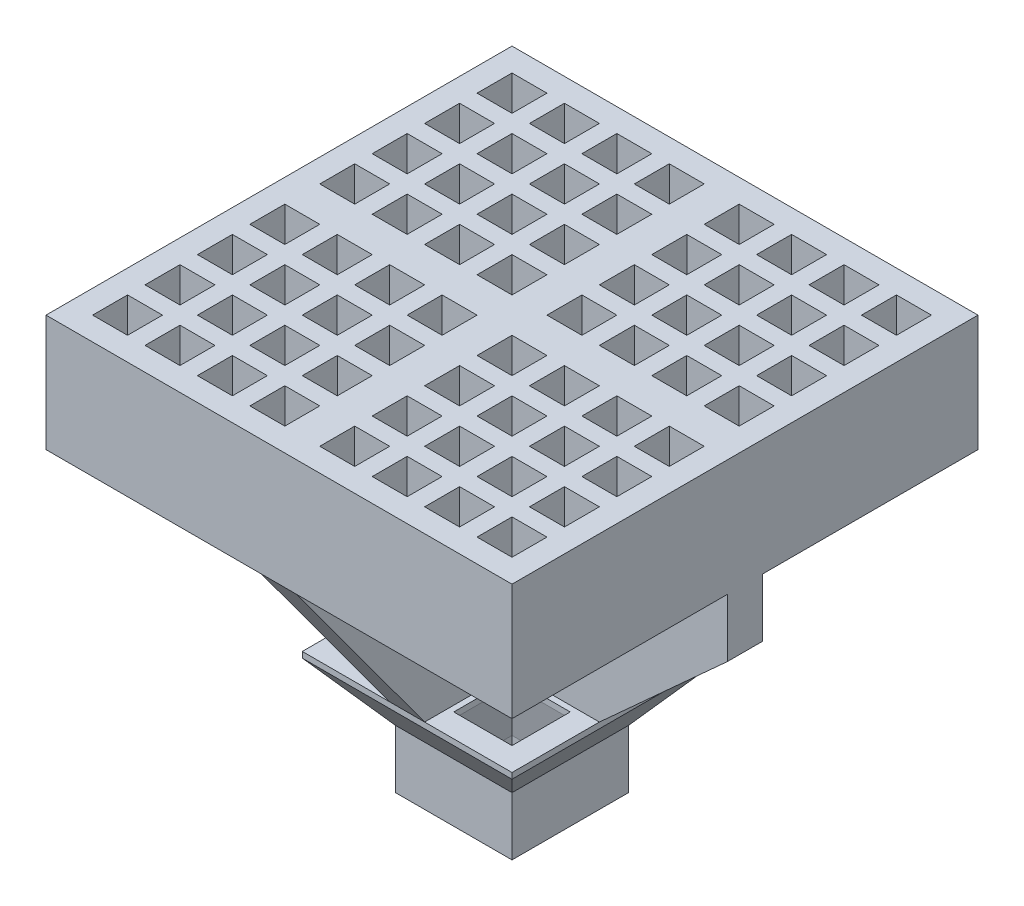
from build123d import *

# Parameters (mm, degrees)
TOP_PANEL_W              = 4
TOP_PANEL_H              = 4
BOSS_EXTRUDE1_DEPTH      = 1
WELLS_1_W                = 0.3
WELLS_1_H                = 0.3
WELLS_1_CUT_DEPTH        = 1
WELLS_2_W                = 0.3
WELLS_2_H                = 0.3
WELLS_2_CUT_DEPTH        = 1
WELLS_3_W                = 0.3
WELLS_3_H                = 0.3
WELLS_3_CUT_DEPTH        = 1
WELLS_4_W                = 0.3
WELLS_4_H                = 0.3
WELLS_4_CUT_DEPTH        = 1
TOP_SUPPORT_1_W          = 4
TOP_SUPPORT_1_H          = 0.3
TOP_SUPPORT_EXTR_1_DEPTH = 0.5
TOP_MID_EXTR_1_START     = -0.15
TOP_MID_EXTR_1_DEPTH     = 0.3
SKETCH11_W               = 1.8
SKETCH11_H               = 1.8
MID_PLANE_DEPTH          = 0.05
MID_WELL_1_W             = 0.5
MID_WELL_1_H             = 0.5
MID_WELL_1_ETR_DEPTH     = 0.3
MID_WELL_4_W             = 0.5
MID_WELL_4_H             = 0.5
MID_WELL_2_ETR_DEPTH     = 0.3
MID_WELL_3_W             = 0.5
MID_WELL_3_H             = 0.5
MID_WELL_3_ETR_DEPTH     = 0.3
MID_WELL_2_W             = 0.5
MID_WELL_2_H             = 0.5
MID_WELL_4_ETR_DEPTH     = 0.3
SKETCH16_4_W             = 1
SKETCH16_4_H             = 1
BOSS_EXTRUDE5_DEPTH      = 0.5
SKETCH19_2_W             = 0.3
SKETCH19_2_H             = 0.3
CUT_EXTRUDE9_DEPTH       = 0.5
SKETCH22_2_W             = 0.3
SKETCH22_2_H             = 0.3
CUT_EXTRUDE10_DEPTH      = 0.5
SKETCH20_2_W             = 0.3
SKETCH20_2_H             = 0.3
CUT_EXTRUDE11_DEPTH      = 0.5
SKETCH21_2_W             = 0.3
SKETCH21_2_H             = 0.3
CUT_EXTRUDE12_DEPTH      = 0.5


# Read off the part's stored shape, not the designer's step: top_mid_extr_1
with BuildPart() as part:
    # top panel → Boss-Extrude1 (new body)
    with BuildSketch(Plane(origin=(0, 0, 0), x_dir=(1, 0, 0), z_dir=(0, 1, 0))):
        Rectangle(TOP_PANEL_W, TOP_PANEL_H)
    extrude(amount=-BOSS_EXTRUDE1_DEPTH)

    # wells_1 → wells_1_cut (cut)
    with BuildSketch(Plane(origin=(0, 0, 0), x_dir=(1, 0, 0), z_dir=(0, 1, 0))):
        with Locations((-1.65, 1.65)):
            Rectangle(WELLS_1_W, WELLS_1_H)
        with Locations((-1.2, 1.65)):
            Rectangle(WELLS_1_W, WELLS_1_H)
        with Locations((-0.75, 1.65)):
            Rectangle(WELLS_1_W, WELLS_1_H)
        with Locations((-0.3, 1.65)):
            Rectangle(WELLS_1_W, WELLS_1_H)
        with Locations((-1.2, 1.2)):
            Rectangle(WELLS_1_W, WELLS_1_H)
        with Locations((-0.75, 1.2)):
            Rectangle(WELLS_1_W, WELLS_1_H)
        with Locations((-0.3, 1.2)):
            Rectangle(WELLS_1_W, WELLS_1_H)
        with Locations((-1.2, 0.75)):
            Rectangle(WELLS_1_W, WELLS_1_H)
        with Locations((-0.75, 0.75)):
            Rectangle(WELLS_1_W, WELLS_1_H)
        with Locations((-0.3, 0.75)):
            Rectangle(WELLS_1_W, WELLS_1_H)
        with Locations((-1.2, 0.3)):
            Rectangle(WELLS_1_W, WELLS_1_H)
        with Locations((-0.75, 0.3)):
            Rectangle(WELLS_1_W, WELLS_1_H)
        with Locations((-0.3, 0.3)):
            Rectangle(WELLS_1_W, WELLS_1_H)
        with Locations((-1.65, 1.2)):
            Rectangle(WELLS_1_W, WELLS_1_H)
        with Locations((-1.65, 0.75)):
            Rectangle(WELLS_1_W, WELLS_1_H)
        with Locations((-1.65, 0.3)):
            Rectangle(WELLS_1_W, WELLS_1_H)
    extrude(amount=-WELLS_1_CUT_DEPTH, mode=Mode.SUBTRACT)

    # wells_2 → wells_2_cut (cut)
    with BuildSketch(Plane(origin=(0, 0, 0), x_dir=(1, 0, 0), z_dir=(0, 1, 0))):
        with Locations((1.65, 1.65)):
            Rectangle(WELLS_2_W, WELLS_2_H)
        with Locations((1.2, 1.65)):
            Rectangle(WELLS_2_W, WELLS_2_H)
        with Locations((0.75, 1.65)):
            Rectangle(WELLS_2_W, WELLS_2_H)
        with Locations((0.3, 1.65)):
            Rectangle(WELLS_2_W, WELLS_2_H)
        with Locations((1.2, 1.2)):
            Rectangle(WELLS_2_W, WELLS_2_H)
        with Locations((0.75, 1.2)):
            Rectangle(WELLS_2_W, WELLS_2_H)
        with Locations((0.3, 1.2)):
            Rectangle(WELLS_2_W, WELLS_2_H)
        with Locations((1.2, 0.75)):
            Rectangle(WELLS_2_W, WELLS_2_H)
        with Locations((0.75, 0.75)):
            Rectangle(WELLS_2_W, WELLS_2_H)
        with Locations((0.3, 0.75)):
            Rectangle(WELLS_2_W, WELLS_2_H)
        with Locations((1.2, 0.3)):
            Rectangle(WELLS_2_W, WELLS_2_H)
        with Locations((0.75, 0.3)):
            Rectangle(WELLS_2_W, WELLS_2_H)
        with Locations((0.3, 0.3)):
            Rectangle(WELLS_2_W, WELLS_2_H)
        with Locations((1.65, 1.2)):
            Rectangle(WELLS_2_W, WELLS_2_H)
        with Locations((1.65, 0.75)):
            Rectangle(WELLS_2_W, WELLS_2_H)
        with Locations((1.65, 0.3)):
            Rectangle(WELLS_2_W, WELLS_2_H)
    extrude(amount=-WELLS_2_CUT_DEPTH, mode=Mode.SUBTRACT)

    # wells_3 → wells_3_cut (cut)
    with BuildSketch(Plane(origin=(0, 0, 0), x_dir=(1, 0, 0), z_dir=(0, 1, 0))):
        with Locations((1.65, -1.65)):
            Rectangle(WELLS_3_W, WELLS_3_H)
        with Locations((1.2, -1.65)):
            Rectangle(WELLS_3_W, WELLS_3_H)
        with Locations((0.75, -1.65)):
            Rectangle(WELLS_3_W, WELLS_3_H)
        with Locations((0.3, -1.65)):
            Rectangle(WELLS_3_W, WELLS_3_H)
        with Locations((1.2, -1.2)):
            Rectangle(WELLS_3_W, WELLS_3_H)
        with Locations((0.75, -1.2)):
            Rectangle(WELLS_3_W, WELLS_3_H)
        with Locations((0.3, -1.2)):
            Rectangle(WELLS_3_W, WELLS_3_H)
        with Locations((1.2, -0.75)):
            Rectangle(WELLS_3_W, WELLS_3_H)
        with Locations((0.75, -0.75)):
            Rectangle(WELLS_3_W, WELLS_3_H)
        with Locations((0.3, -0.75)):
            Rectangle(WELLS_3_W, WELLS_3_H)
        with Locations((1.2, -0.3)):
            Rectangle(WELLS_3_W, WELLS_3_H)
        with Locations((0.75, -0.3)):
            Rectangle(WELLS_3_W, WELLS_3_H)
        with Locations((0.3, -0.3)):
            Rectangle(WELLS_3_W, WELLS_3_H)
        with Locations((1.65, -1.2)):
            Rectangle(WELLS_3_W, WELLS_3_H)
        with Locations((1.65, -0.75)):
            Rectangle(WELLS_3_W, WELLS_3_H)
        with Locations((1.65, -0.3)):
            Rectangle(WELLS_3_W, WELLS_3_H)
    extrude(amount=-WELLS_3_CUT_DEPTH, mode=Mode.SUBTRACT)

    # wells_4 → wells_4_cut (cut)
    with BuildSketch(Plane(origin=(0, 0, 0), x_dir=(1, 0, 0), z_dir=(0, 1, 0))):
        with Locations((-1.65, -1.65)):
            Rectangle(WELLS_4_W, WELLS_4_H)
        with Locations((-1.2, -1.65)):
            Rectangle(WELLS_4_W, WELLS_4_H)
        with Locations((-0.75, -1.65)):
            Rectangle(WELLS_4_W, WELLS_4_H)
        with Locations((-0.3, -1.65)):
            Rectangle(WELLS_4_W, WELLS_4_H)
        with Locations((-1.2, -1.2)):
            Rectangle(WELLS_4_W, WELLS_4_H)
        with Locations((-0.75, -1.2)):
            Rectangle(WELLS_4_W, WELLS_4_H)
        with Locations((-0.3, -1.2)):
            Rectangle(WELLS_4_W, WELLS_4_H)
        with Locations((-1.2, -0.75)):
            Rectangle(WELLS_4_W, WELLS_4_H)
        with Locations((-0.75, -0.75)):
            Rectangle(WELLS_4_W, WELLS_4_H)
        with Locations((-0.3, -0.75)):
            Rectangle(WELLS_4_W, WELLS_4_H)
        with Locations((-1.2, -0.3)):
            Rectangle(WELLS_4_W, WELLS_4_H)
        with Locations((-0.75, -0.3)):
            Rectangle(WELLS_4_W, WELLS_4_H)
        with Locations((-0.3, -0.3)):
            Rectangle(WELLS_4_W, WELLS_4_H)
        with Locations((-1.65, -1.2)):
            Rectangle(WELLS_4_W, WELLS_4_H)
        with Locations((-1.65, -0.75)):
            Rectangle(WELLS_4_W, WELLS_4_H)
        with Locations((-1.65, -0.3)):
            Rectangle(WELLS_4_W, WELLS_4_H)
    extrude(amount=-WELLS_4_CUT_DEPTH, mode=Mode.SUBTRACT)

    # top_support_1 → top_support_extr_1 (add)
    with BuildSketch(Plane(origin=(0, -1, 0), x_dir=(-1, 0, 0), z_dir=(0, -1, 0))):
        Rectangle(TOP_SUPPORT_1_W, TOP_SUPPORT_1_H)
    extrude(amount=TOP_SUPPORT_EXTR_1_DEPTH)

    # top_mid_extr_1 outline → top_mid_extr_1 (add)
    with BuildSketch(Plane.XY.offset(TOP_MID_EXTR_1_START)):
        Polygon((-2, -1.5), (-0.9, -2.5), (0.9, -2.5), (2, -1.5), align=None)
    extrude(amount=TOP_MID_EXTR_1_DEPTH)

    # mid_support_2 → top_mid_extr_2 section 0
    with BuildSketch(Plane(origin=(0, -2.5, 0), x_dir=(1, 0, 0), z_dir=(0, 1, 0))):
        with BuildLine():
            Line((0.15, 0.9), (-0.15, 0.9))
            Line((-0.15, 0.9), (-0.15, -0.9))
            Line((-0.15, -0.9), (0.15, -0.9))
            Line((0.15, -0.9), (0.15, 0.9))
        make_face()
    # top_support_2 → top_mid_extr_2 section 1
    with BuildSketch(Plane(origin=(0, -1, 0), x_dir=(-1, 0, 0), z_dir=(0, -1, 0))):
        with BuildLine():
            Line((-0.15, 2), (-0.15, -2))
            Line((-0.15, -2), (0.15, -2))
            Line((0.15, -2), (0.15, 2))
            Line((0.15, 2), (-0.15, 2))
        make_face()
    loft()

    # Sketch11 → mid_plane (add)
    with BuildSketch(Plane(origin=(0, -2.5, 0), x_dir=(1, 0, 0), z_dir=(0, 1, 0))):
        Rectangle(SKETCH11_W, SKETCH11_H)
    extrude(amount=-MID_PLANE_DEPTH)

    # mid_well_1 → mid_well_1_etr (cut)
    with BuildSketch(Plane(origin=(0, -2.55, 0), x_dir=(-1, 0, 0), z_dir=(0, -1, 0))):
        with Locations((0.45, -0.45)):
            Rectangle(MID_WELL_1_W, MID_WELL_1_H)
    extrude(amount=-MID_WELL_1_ETR_DEPTH, mode=Mode.SUBTRACT)

    # mid_well_4 → mid_well_2_etr (cut)
    with BuildSketch(Plane(origin=(0, -2.55, 0), x_dir=(-1, 0, 0), z_dir=(0, -1, 0))):
        with Locations((0.45, 0.45)):
            Rectangle(MID_WELL_4_W, MID_WELL_4_H)
    extrude(amount=-MID_WELL_2_ETR_DEPTH, mode=Mode.SUBTRACT)

    # mid_well_3 → mid_well_3_etr (cut)
    with BuildSketch(Plane(origin=(0, -2.55, 0), x_dir=(-1, 0, 0), z_dir=(0, -1, 0))):
        with Locations((-0.45, 0.45)):
            Rectangle(MID_WELL_3_W, MID_WELL_3_H)
    extrude(amount=-MID_WELL_3_ETR_DEPTH, mode=Mode.SUBTRACT)

    # mid_well_2 → mid_well_4_etr (cut)
    with BuildSketch(Plane(origin=(0, -2.55, 0), x_dir=(-1, 0, 0), z_dir=(0, -1, 0))):
        with Locations((-0.45, -0.45)):
            Rectangle(MID_WELL_2_W, MID_WELL_2_H)
    extrude(amount=-MID_WELL_4_ETR_DEPTH, mode=Mode.SUBTRACT)

    # Sketch17 → Loft4 section 0
    with BuildSketch(Plane(origin=(0, -2.55, 0), x_dir=(-1, 0, 0), z_dir=(0, -1, 0))):
        with BuildLine():
            Line((0.9, -0.9), (-0.9, -0.9))
            Line((-0.9, -0.9), (-0.9, 0.9))
            Line((-0.9, 0.9), (0.9, 0.9))
            Line((0.9, 0.9), (0.9, -0.9))
        make_face()
    # Sketch16 → Loft4 section 1
    with BuildSketch(Plane(origin=(0, -3.05, 0), x_dir=(1, 0, 0), z_dir=(0, 1, 0))):
        with BuildLine():
            Line((0.5, 0.5), (-0.5, 0.5))
            Line((-0.5, 0.5), (-0.5, -0.5))
            Line((-0.5, -0.5), (0.5, -0.5))
            Line((0.5, -0.5), (0.5, 0.5))
        make_face()
    loft()

    # mid_well_1<2> → bottom_well_1 section 0
    with BuildSketch(Plane(origin=(0, -2.55, 0), x_dir=(-1, 0, 0), z_dir=(0, -1, 0))):
        with BuildLine():
            Line((0.2, -0.2), (0.7, -0.2))
            Line((0.7, -0.2), (0.7, -0.7))
            Line((0.7, -0.7), (0.2, -0.7))
            Line((0.2, -0.7), (0.2, -0.2))
        make_face()
    # Sketch19 → bottom_well_1 section 1
    with BuildSketch(Plane(origin=(0, -3.05, 0), x_dir=(1, 0, 0), z_dir=(0, 1, 0))):
        with BuildLine():
            Line((-0.075, -0.075), (-0.375, -0.075))
            Line((-0.375, -0.075), (-0.375, -0.375))
            Line((-0.375, -0.375), (-0.075, -0.375))
            Line((-0.075, -0.375), (-0.075, -0.075))
        make_face()
    loft(mode=Mode.SUBTRACT)

    # mid_well_4<2> → bottom_well_2 section 0
    with BuildSketch(Plane(origin=(0, -2.55, 0), x_dir=(-1, 0, 0), z_dir=(0, -1, 0))):
        with BuildLine():
            Line((0.7, 0.7), (0.2, 0.7))
            Line((0.2, 0.7), (0.2, 0.2))
            Line((0.2, 0.2), (0.7, 0.2))
            Line((0.7, 0.2), (0.7, 0.7))
        make_face()
    # Sketch22 → bottom_well_2 section 1
    with BuildSketch(Plane(origin=(0, -3.05, 0), x_dir=(1, 0, 0), z_dir=(0, 1, 0))):
        with BuildLine():
            Line((-0.075, 0.075), (-0.375, 0.075))
            Line((-0.375, 0.075), (-0.375, 0.375))
            Line((-0.375, 0.375), (-0.075, 0.375))
            Line((-0.075, 0.375), (-0.075, 0.075))
        make_face()
    loft(mode=Mode.SUBTRACT)

    # Sketch20 → bottom_well_3 section 0
    with BuildSketch(Plane(origin=(0, -3.05, 0), x_dir=(1, 0, 0), z_dir=(0, 1, 0))):
        with BuildLine():
            Line((0.075, -0.075), (0.375, -0.075))
            Line((0.375, -0.075), (0.375, -0.375))
            Line((0.375, -0.375), (0.075, -0.375))
            Line((0.075, -0.375), (0.075, -0.075))
        make_face()
    # mid_well_2<2> → bottom_well_3 section 1
    with BuildSketch(Plane(origin=(0, -2.55, 0), x_dir=(-1, 0, 0), z_dir=(0, -1, 0))):
        with BuildLine():
            Line((-0.7, -0.7), (-0.2, -0.7))
            Line((-0.2, -0.7), (-0.2, -0.2))
            Line((-0.2, -0.2), (-0.7, -0.2))
            Line((-0.7, -0.2), (-0.7, -0.7))
        make_face()
    loft(mode=Mode.SUBTRACT)

    # Sketch21 → bottom_well_4 section 0
    with BuildSketch(Plane(origin=(0, -3.05, 0), x_dir=(1, 0, 0), z_dir=(0, 1, 0))):
        with BuildLine():
            Line((0.075, 0.075), (0.375, 0.075))
            Line((0.375, 0.075), (0.375, 0.375))
            Line((0.375, 0.375), (0.075, 0.375))
            Line((0.075, 0.375), (0.075, 0.075))
        make_face()
    # mid_well_3<2> → bottom_well_4 section 1
    with BuildSketch(Plane(origin=(0, -2.55, 0), x_dir=(-1, 0, 0), z_dir=(0, -1, 0))):
        with BuildLine():
            Line((-0.7, 0.7), (-0.2, 0.7))
            Line((-0.2, 0.7), (-0.2, 0.2))
            Line((-0.2, 0.2), (-0.7, 0.2))
            Line((-0.7, 0.2), (-0.7, 0.7))
        make_face()
    loft(mode=Mode.SUBTRACT)

    # Sketch16<4> → Boss-Extrude5 (add)
    with BuildSketch(Plane(origin=(0, -3.05, 0), x_dir=(1, 0, 0), z_dir=(0, 1, 0))):
        Rectangle(SKETCH16_4_W, SKETCH16_4_H)
    extrude(amount=-BOSS_EXTRUDE5_DEPTH)

    # Sketch19<2> → Cut-Extrude9 (cut)
    with BuildSketch(Plane(origin=(0, -3.05, 0), x_dir=(1, 0, 0), z_dir=(0, 1, 0))):
        with Locations((-0.225, -0.225)):
            Rectangle(SKETCH19_2_W, SKETCH19_2_H)
    extrude(amount=-CUT_EXTRUDE9_DEPTH, mode=Mode.SUBTRACT)

    # Sketch22<2> → Cut-Extrude10 (cut)
    with BuildSketch(Plane(origin=(0, -3.05, 0), x_dir=(1, 0, 0), z_dir=(0, 1, 0))):
        with Locations((-0.225, 0.225)):
            Rectangle(SKETCH22_2_W, SKETCH22_2_H)
    extrude(amount=-CUT_EXTRUDE10_DEPTH, mode=Mode.SUBTRACT)

    # Sketch20<2> → Cut-Extrude11 (cut)
    with BuildSketch(Plane(origin=(0, -3.05, 0), x_dir=(1, 0, 0), z_dir=(0, 1, 0))):
        with Locations((0.225, -0.225)):
            Rectangle(SKETCH20_2_W, SKETCH20_2_H)
    extrude(amount=-CUT_EXTRUDE11_DEPTH, mode=Mode.SUBTRACT)

    # Sketch21<2> → Cut-Extrude12 (cut)
    with BuildSketch(Plane(origin=(0, -3.05, 0), x_dir=(1, 0, 0), z_dir=(0, 1, 0))):
        with Locations((0.225, 0.225)):
            Rectangle(SKETCH21_2_W, SKETCH21_2_H)
    extrude(amount=-CUT_EXTRUDE12_DEPTH, mode=Mode.SUBTRACT)


solid = part.part
